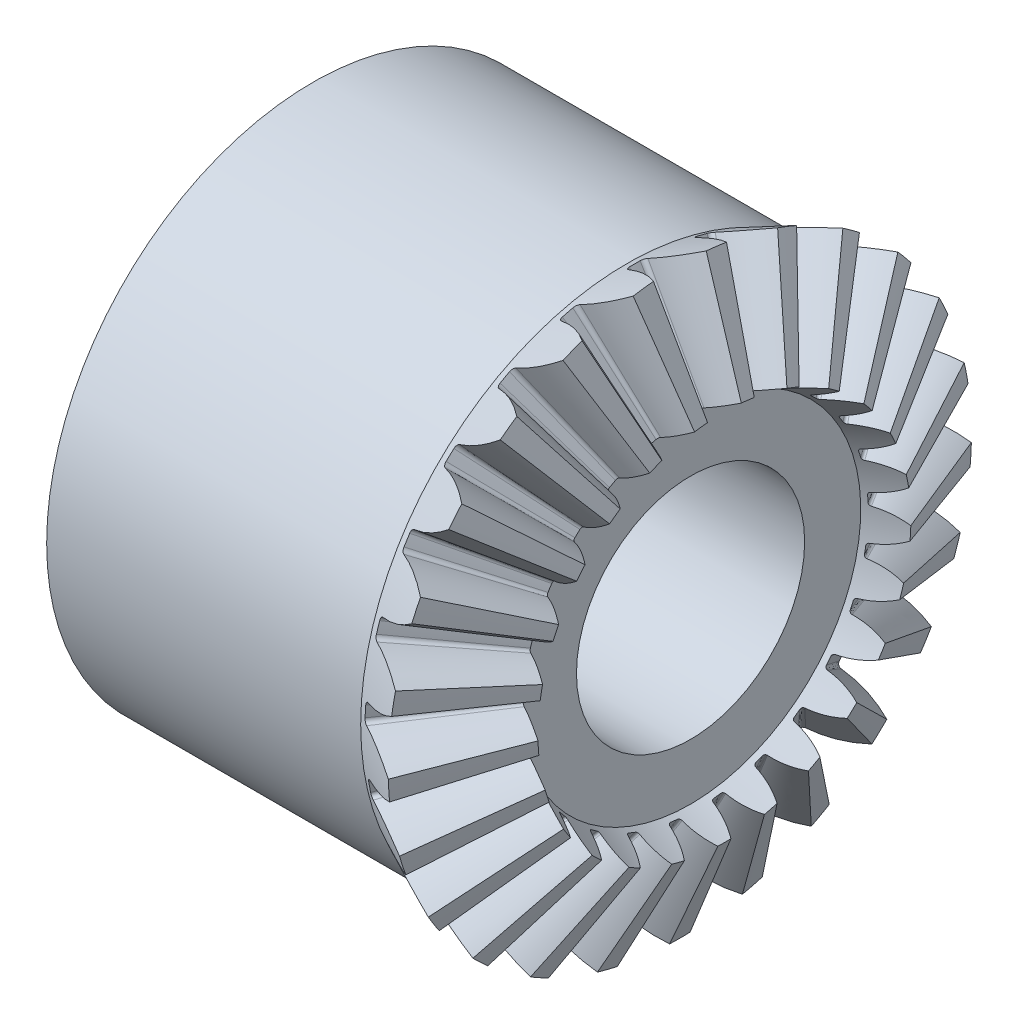
from build123d import *

# Parameters (mm, degrees)
TEETHCUTS_COUNT     = 25
TEETHCUTS_ANGLE     = 345.6
HUBSKE_R            = 23.331263511
HUB_DEPTH           = 14.523567249
BORSKE_R            = 10
BORE_DEPTH          = 30.0000508
SKETCH3_R           = 23.331263511
SKETCH3_R_2         = 10
BOSS_EXTRUDE1_DEPTH = 13


with BuildPart() as part:
    # BasProSke → Base-Revolve (revolve)
    with BuildSketch(Plane(origin=(0, 0, 0), x_dir=(1, 0, 0), z_dir=(0, 1, 0)), mode=Mode.PRIVATE) as base_revolve_sk:
        Polygon((0, 0), (0, 23.331263516), (4.641273296, 25.55907469), (8.548568355, 16.34223662), (5.580981017, 14.917794703), (5.580981017, 0), align=None)
    revolve(base_revolve_sk.sketch.rotate(Axis((-10, 0, 0), (1, 0, 0)), 180), axis=Axis((-10, 0, 0), (1, 0, 0)))

    # ToothCut: read off the stored shape, not the designer's step
    # ToothCut: loft between two sections, ruled curve by curve
    toothcut_from = [
        Edge.make_bspline([(15.485238682, 0.004178078, -0.008250312), (15.479699714, 0.001519373, -0.015440524), (15.471200427, -0.002560285, -0.014687839), (15.466760104, -0.004691639, -0.006613875)], [0, 0, 0, 0, 1, 1, 1, 1], 3, [1, 0.72471089, 0.72471089, 1]),
        Edge.make_bspline([(15.466760104, -0.004691639, 0.006613875), (15.471200427, -0.002560285, 0.014687839), (15.479699714, 0.001519373, 0.015440524), (15.485238682, 0.004178078, 0.008250312)], [0, 0, 0, 0, 1, 1, 1, 1], 3, [1, 0.72471089, 0.72471089, 1]),
        Edge.make_bspline([(15.466760104, -0.004691639, -0.006613875), (15.466198007, -0.004961446, -0.005591798), (15.465770918, -0.005166449, -0.004492271), (15.465487306, -0.005302583, -0.003337099)], [0, 0, 0, 0, 1, 1, 1, 1], 3, [1, 0.993389772, 0.993389772, 1]),
        Edge.make_bspline([(15.465487306, -0.005302583, 0.003337099), (15.465770918, -0.005166449, 0.004492271), (15.466198007, -0.004961446, 0.005591798), (15.466760104, -0.004691639, 0.006613875)], [0, 0, 0, 0, 1, 1, 1, 1], 3, [1, 0.993389772, 0.993389772, 1]),
        Edge.make_bspline([(15.465487306, -0.005302583, -0.003337099), (15.464947652, -0.005561617, -0.00113905), (15.464947652, -0.005561617, 0.00113905), (15.465487306, -0.005302583, 0.003337099)], [0, 0, 0, 0, 1, 1, 1, 1], 3, [1, 0.976573485, 0.976573485, 1]),
        Edge.make_line((15.485238682, 0.004178078, 0.008250312), (15.485238682, 0.004178078, -0.008250312)),
    ]
    toothcut_to = [
        Edge.make_bspline([(5.000050597, 25.731287794, -2.615742634), (3.804495635, 25.157421415, -1.670162832), (2.439533055, 24.502239378, -1.069822011), (0.984659471, 23.80390006, -0.849684546)], [0, 0, 0, 0, 1, 1, 1, 1], 3, [1, 0.980586375, 0.980586375, 1]),
        Edge.make_bspline([(0.984659471, 23.80390006, 0.849684546), (2.439533055, 24.502239378, 1.069822011), (3.804495635, 25.157421415, 1.670162832), (5.000050597, 25.731287794, 2.615742634)], [0, 0, 0, 0, 1, 1, 1, 1], 3, [1, 0.980586375, 0.980586375, 1]),
        Edge.make_bspline([(0.984659471, 23.80390006, -0.849684546), (0.804814372, 23.717574413, -0.822472117), (0.686922602, 23.660986364, -0.6693832), (0.690799567, 23.662847307, -0.468091374)], [0, 0, 0, 0, 1, 1, 1, 1], 3, [1, 0.830874805, 0.830874805, 1]),
        Edge.make_bspline([(0.690799567, 23.662847307, 0.468091374), (0.686922602, 23.660986364, 0.6693832), (0.804814372, 23.717574413, 0.822472117), (0.984659471, 23.80390006, 0.849684546)], [0, 0, 0, 0, 1, 1, 1, 1], 3, [1, 0.830874805, 0.830874805, 1]),
        Edge.make_bspline([(0.690799567, 23.662847307, -0.468091374), (0.696809534, 23.665732091, -0.156054193), (0.696809534, 23.665732091, 0.156054193), (0.690799567, 23.662847307, 0.468091374)], [0, 0, 0, 0, 1, 1, 1, 1], 3, [1, 0.999847907, 0.999847907, 1]),
        Edge.make_line((5.000050597, 25.731287794, 2.615742634), (5.000050597, 25.731287794, -2.615742634)),
    ]
    toothcut = Solid(Shell([*[Face.make_surface_from_curves(toothcut_from[k], toothcut_to[k]) for k in range(6)], Face(Wire(toothcut_from)), Face(Wire(toothcut_to))]))
    add(toothcut, mode=Mode.SUBTRACT)

    # TeethCuts: ToothCut ×25 about axis
    teethcuts_axis = Axis((-10, 0, 0), (1, 0, 0))
    for i in range(1, TEETHCUTS_COUNT):
        add(toothcut.rotate(teethcuts_axis, i * TEETHCUTS_ANGLE / (TEETHCUTS_COUNT - 1)), mode=Mode.SUBTRACT)

    # HubSke → Hub (add)
    with BuildSketch(Plane.ZY):
        Circle(HUBSKE_R)
    extrude(amount=HUB_DEPTH)

    # BorSke → Bore (cut, symmetric)
    with BuildSketch(Plane(origin=(0, 0, 0), x_dir=(0, 0, -1), z_dir=(1, 0, 0))):
        with Locations(Location((0, 0, 0), (0, 0, 180))):
            Circle(BORSKE_R)
    extrude(amount=BORE_DEPTH, both=True, mode=Mode.SUBTRACT)

    # Sketch3 → Boss-Extrude1 (add)
    with BuildSketch(Plane.ZY.offset(14.523567249)):
        Circle(SKETCH3_R)
        Circle(SKETCH3_R_2, mode=Mode.SUBTRACT)
    extrude(amount=BOSS_EXTRUDE1_DEPTH)


solid = part.part
